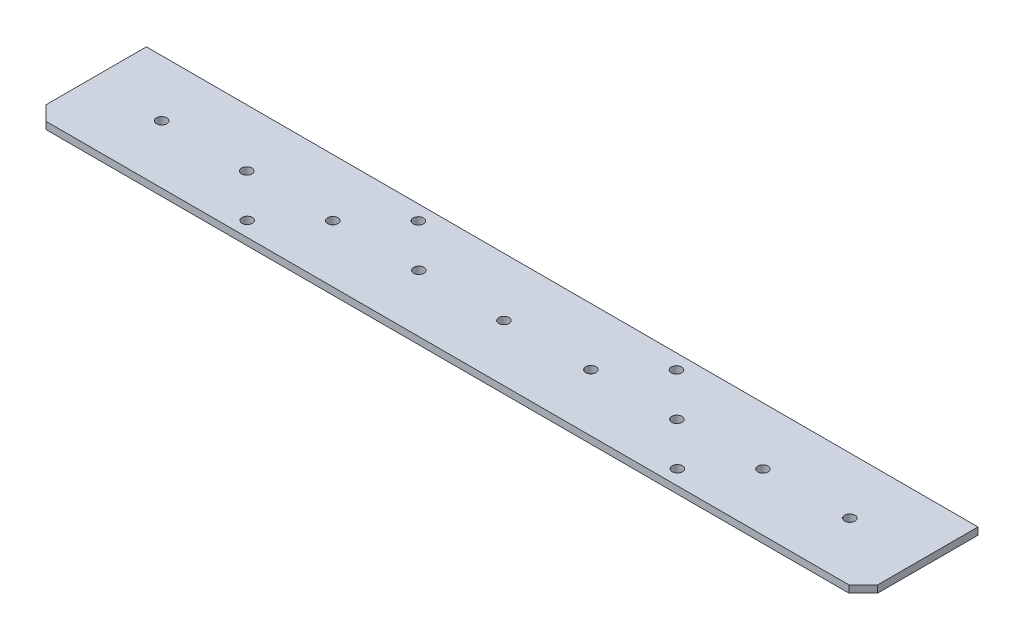
from build123d import *

# Parameters (mm, degrees)
SKETCH2_W           = 368.3
SKETCH2_H           = 50.8
BOSS_EXTRUDE1_DEPTH = 3.175
CUT_EXTRUDE1_REACH  = 373.8
SKETCH3_R           = 2.286


with BuildPart() as part:
    # Sketch2 → Boss-Extrude1 (new body)
    with BuildSketch(Plane(origin=(0, 0, 0), x_dir=(1, 0, 0), z_dir=(0, 1, 0))):
        with Locations((184.15, 25.4)):
            Rectangle(SKETCH2_W, SKETCH2_H)
    extrude(amount=BOSS_EXTRUDE1_DEPTH)

    # Sketch3 → Cut-Extrude1 (cut, up to next)
    with BuildSketch(Plane(origin=(0, 3.175, 0), x_dir=(1, 0, 0), z_dir=(0, 1, 0)), mode=Mode.PRIVATE) as cut_extrude1_sk1:
        with Locations((184.15, 25.003125)):
            Circle(SKETCH3_R)
    cut_extrude1_tool1 = extrude(cut_extrude1_sk1.sketch, amount=-CUT_EXTRUDE1_REACH, mode=Mode.PRIVATE) & part.part
    # Sketch3 → Cut-Extrude1 (cut, up to next)
    with BuildSketch(Plane(origin=(0, 3.175, 0), x_dir=(1, 0, 0), z_dir=(0, 1, 0)), mode=Mode.PRIVATE) as cut_extrude1_sk2:
        with Locations((31.75, 25.796875)):
            Circle(SKETCH3_R)
    cut_extrude1_tool2 = extrude(cut_extrude1_sk2.sketch, amount=-CUT_EXTRUDE1_REACH, mode=Mode.PRIVATE) & part.part
    # Sketch3 → Cut-Extrude1 (cut, up to next)
    with BuildSketch(Plane(origin=(0, 3.175, 0), x_dir=(1, 0, 0), z_dir=(0, 1, 0)), mode=Mode.PRIVATE) as cut_extrude1_sk3:
        with Locations((107.95, 25.4)):
            Circle(SKETCH3_R)
    cut_extrude1_tool3 = extrude(cut_extrude1_sk3.sketch, amount=-CUT_EXTRUDE1_REACH, mode=Mode.PRIVATE) & part.part
    # Sketch3 → Cut-Extrude1 (cut, up to next)
    with BuildSketch(Plane(origin=(0, 3.175, 0), x_dir=(1, 0, 0), z_dir=(0, 1, 0)), mode=Mode.PRIVATE) as cut_extrude1_sk4:
        with Locations((69.85, 25.4)):
            Circle(SKETCH3_R)
    cut_extrude1_tool4 = extrude(cut_extrude1_sk4.sketch, amount=-CUT_EXTRUDE1_REACH, mode=Mode.PRIVATE) & part.part
    # Sketch3 → Cut-Extrude1 (cut, up to next)
    with BuildSketch(Plane(origin=(0, 3.175, 0), x_dir=(1, 0, 0), z_dir=(0, 1, 0)), mode=Mode.PRIVATE) as cut_extrude1_sk5:
        with Locations((146.05, 25.4)):
            Circle(SKETCH3_R)
    cut_extrude1_tool5 = extrude(cut_extrude1_sk5.sketch, amount=-CUT_EXTRUDE1_REACH, mode=Mode.PRIVATE) & part.part
    # Sketch3 → Cut-Extrude1 (cut, up to next)
    with BuildSketch(Plane(origin=(0, 3.175, 0), x_dir=(1, 0, 0), z_dir=(0, 1, 0)), mode=Mode.PRIVATE) as cut_extrude1_sk6:
        with Locations((222.25, 25.4)):
            Circle(SKETCH3_R)
    cut_extrude1_tool6 = extrude(cut_extrude1_sk6.sketch, amount=-CUT_EXTRUDE1_REACH, mode=Mode.PRIVATE) & part.part
    # Sketch3 → Cut-Extrude1 (cut, up to next)
    with BuildSketch(Plane(origin=(0, 3.175, 0), x_dir=(1, 0, 0), z_dir=(0, 1, 0)), mode=Mode.PRIVATE) as cut_extrude1_sk7:
        with Locations((298.45, 25.4)):
            Circle(SKETCH3_R)
    cut_extrude1_tool7 = extrude(cut_extrude1_sk7.sketch, amount=-CUT_EXTRUDE1_REACH, mode=Mode.PRIVATE) & part.part
    # Sketch3 → Cut-Extrude1 (cut, up to next)
    with BuildSketch(Plane(origin=(0, 3.175, 0), x_dir=(1, 0, 0), z_dir=(0, 1, 0)), mode=Mode.PRIVATE) as cut_extrude1_sk8:
        with Locations((260.35, 25.4)):
            Circle(SKETCH3_R)
    cut_extrude1_tool8 = extrude(cut_extrude1_sk8.sketch, amount=-CUT_EXTRUDE1_REACH, mode=Mode.PRIVATE) & part.part
    # Sketch3 → Cut-Extrude1 (cut, up to next)
    with BuildSketch(Plane(origin=(0, 3.175, 0), x_dir=(1, 0, 0), z_dir=(0, 1, 0)), mode=Mode.PRIVATE) as cut_extrude1_sk9:
        with Locations((336.55, 25.796875)):
            Circle(SKETCH3_R)
    cut_extrude1_tool9 = extrude(cut_extrude1_sk9.sketch, amount=-CUT_EXTRUDE1_REACH, mode=Mode.PRIVATE) & part.part
    # Sketch3 → Cut-Extrude1 (cut, up to next)
    with BuildSketch(Plane(origin=(0, 3.175, 0), x_dir=(1, 0, 0), z_dir=(0, 1, 0)), mode=Mode.PRIVATE) as cut_extrude1_sk10:
        with Locations((241.3, 44.252590674)):
            Circle(SKETCH3_R)
    cut_extrude1_tool10 = extrude(cut_extrude1_sk10.sketch, amount=-CUT_EXTRUDE1_REACH, mode=Mode.PRIVATE) & part.part
    # Sketch3 → Cut-Extrude1 (cut, up to next)
    with BuildSketch(Plane(origin=(0, 3.175, 0), x_dir=(1, 0, 0), z_dir=(0, 1, 0)), mode=Mode.PRIVATE) as cut_extrude1_sk11:
        with Locations((279.4, 6.547409326)):
            Circle(SKETCH3_R)
    cut_extrude1_tool11 = extrude(cut_extrude1_sk11.sketch, amount=-CUT_EXTRUDE1_REACH, mode=Mode.PRIVATE) & part.part
    # Sketch3 → Cut-Extrude1 (cut, up to next)
    with BuildSketch(Plane(origin=(0, 3.175, 0), x_dir=(1, 0, 0), z_dir=(0, 1, 0)), mode=Mode.PRIVATE) as cut_extrude1_sk12:
        with Locations((88.9, 6.547409326)):
            Circle(SKETCH3_R)
    cut_extrude1_tool12 = extrude(cut_extrude1_sk12.sketch, amount=-CUT_EXTRUDE1_REACH, mode=Mode.PRIVATE) & part.part
    # Sketch3 → Cut-Extrude1 (cut, up to next)
    with BuildSketch(Plane(origin=(0, 3.175, 0), x_dir=(1, 0, 0), z_dir=(0, 1, 0)), mode=Mode.PRIVATE) as cut_extrude1_sk13:
        with Locations((127, 44.252590674)):
            Circle(SKETCH3_R)
    cut_extrude1_tool13 = extrude(cut_extrude1_sk13.sketch, amount=-CUT_EXTRUDE1_REACH, mode=Mode.PRIVATE) & part.part
    # Sketch3 → Cut-Extrude1 (cut, up to next)
    with BuildSketch(Plane(origin=(0, 3.175, 0), x_dir=(1, 0, 0), z_dir=(0, 1, 0)), mode=Mode.PRIVATE) as cut_extrude1_sk14:
        Polygon((0, 6.35), (6.35, 0), (0, 0), align=None)
    cut_extrude1_tool14 = extrude(cut_extrude1_sk14.sketch, amount=-CUT_EXTRUDE1_REACH, mode=Mode.PRIVATE) & part.part
    # Sketch3 → Cut-Extrude1 (cut, up to next)
    with BuildSketch(Plane(origin=(0, 3.175, 0), x_dir=(1, 0, 0), z_dir=(0, 1, 0)), mode=Mode.PRIVATE) as cut_extrude1_sk15:
        Polygon((361.95, 0), (368.3, 0), (368.3, 6.35), align=None)
    cut_extrude1_tool15 = extrude(cut_extrude1_sk15.sketch, amount=-CUT_EXTRUDE1_REACH, mode=Mode.PRIVATE) & part.part
    add(cut_extrude1_tool1.solids().sort_by_distance((184.15, 3.175, -25.003125))[0], mode=Mode.SUBTRACT)
    add(cut_extrude1_tool2.solids().sort_by_distance((31.75, 3.175, -25.796875))[0], mode=Mode.SUBTRACT)
    add(cut_extrude1_tool3.solids().sort_by_distance((107.95, 3.175, -25.4))[0], mode=Mode.SUBTRACT)
    add(cut_extrude1_tool4.solids().sort_by_distance((69.85, 3.175, -25.4))[0], mode=Mode.SUBTRACT)
    add(cut_extrude1_tool5.solids().sort_by_distance((146.05, 3.175, -25.4))[0], mode=Mode.SUBTRACT)
    add(cut_extrude1_tool6.solids().sort_by_distance((222.25, 3.175, -25.4))[0], mode=Mode.SUBTRACT)
    add(cut_extrude1_tool7.solids().sort_by_distance((298.45, 3.175, -25.4))[0], mode=Mode.SUBTRACT)
    add(cut_extrude1_tool8.solids().sort_by_distance((260.35, 3.175, -25.4))[0], mode=Mode.SUBTRACT)
    add(cut_extrude1_tool9.solids().sort_by_distance((336.55, 3.175, -25.796875))[0], mode=Mode.SUBTRACT)
    add(cut_extrude1_tool10.solids().sort_by_distance((241.3, 3.175, -44.252591))[0], mode=Mode.SUBTRACT)
    add(cut_extrude1_tool11.solids().sort_by_distance((279.4, 3.175, -6.547409))[0], mode=Mode.SUBTRACT)
    add(cut_extrude1_tool12.solids().sort_by_distance((88.9, 3.175, -6.547409))[0], mode=Mode.SUBTRACT)
    add(cut_extrude1_tool13.solids().sort_by_distance((127, 3.175, -44.252591))[0], mode=Mode.SUBTRACT)
    add(cut_extrude1_tool14.solids().sort_by_distance((2.116667, 3.175, -2.116667))[0], mode=Mode.SUBTRACT)
    add(cut_extrude1_tool15.solids().sort_by_distance((366.183333, 3.175, -2.116667))[0], mode=Mode.SUBTRACT)


solid = part.part
